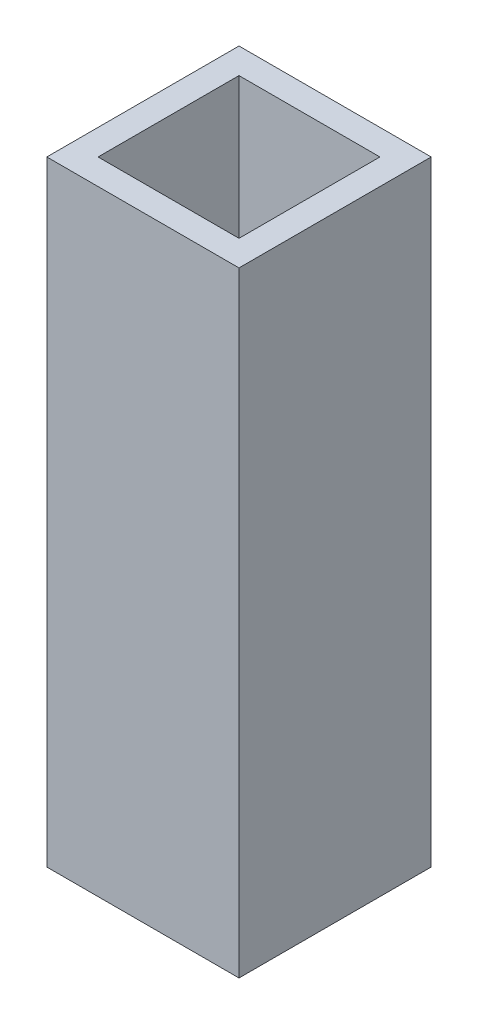
from build123d import *

# Parameters (mm, degrees)
SKETCH1_W           = 15
SKETCH1_H           = 15
SKETCH1_W_2         = 11
SKETCH1_H_2         = 11
BOSS_EXTRUDE1_DEPTH = 48


with BuildPart() as part:
    # Sketch1 → Boss-Extrude1 (new body)
    with BuildSketch(Plane(origin=(0, 0, 0), x_dir=(1, 0, 0), z_dir=(0, 1, 0))):
        with Locations((7.5, 7.5)):
            Rectangle(SKETCH1_W, SKETCH1_H)
        with Locations((7.5, 7.5)):
            Rectangle(SKETCH1_W_2, SKETCH1_H_2, mode=Mode.SUBTRACT)
    extrude(amount=BOSS_EXTRUDE1_DEPTH)


solid = part.part
